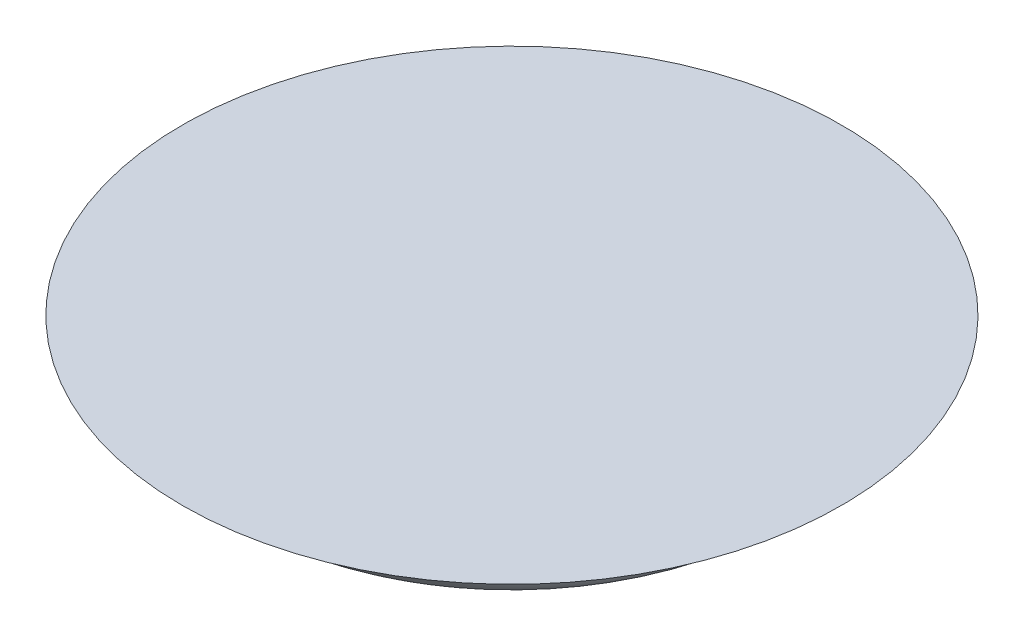
from build123d import *

# Parameters (mm, degrees)
SKETCH1_W           = 203.69051182
SKETCH1_H           = 2
BASE_EXTRUDE_DEPTH  = 60
SKETCH3_R           = 25
BOSS_EXTRUDE1_DEPTH = 5
FILLET_2_R          = 3
FILLET2_R           = 5
SKETCH4_W           = 120
SKETCH4_H           = 2
CUT_EXTRUDE1_DEPTH  = 213.402506245


with BuildPart() as part:
    # Sketch1 → Base-Extrude (new, symmetric)
    with BuildSketch(Plane.XY):
        with Locations((0, 1)):
            Rectangle(SKETCH1_W, SKETCH1_H)
    extrude(amount=BASE_EXTRUDE_DEPTH, both=True)

    # Sketch3 → Boss-Extrude1 (add)
    with BuildSketch(Plane.XZ):
        Circle(SKETCH3_R)
    extrude(amount=BOSS_EXTRUDE1_DEPTH)

    # Fillet 2
    fillet_2_edges = [part.edges().sort_by_distance(p)[0] for p in [
        (-25, -5, 0),
    ]]
    fillet(fillet_2_edges, radius=FILLET_2_R)

    # Fillet2
    fillet2_edges = [part.edges().sort_by_distance(p)[0] for p in [
        (-25, 0, 0),
    ]]
    fillet(fillet2_edges, radius=FILLET2_R)

    # Sketch4 → Cut-Extrude1 (cut, through all)
    with BuildSketch(Plane(origin=(101.84525591, 0, 0), x_dir=(0, 0, -1), z_dir=(1, 0, 0))):
        with Locations((0, 1)):
            Rectangle(SKETCH4_W, SKETCH4_H)
    extrude(amount=-CUT_EXTRUDE1_DEPTH, mode=Mode.SUBTRACT)


solid = part.part
